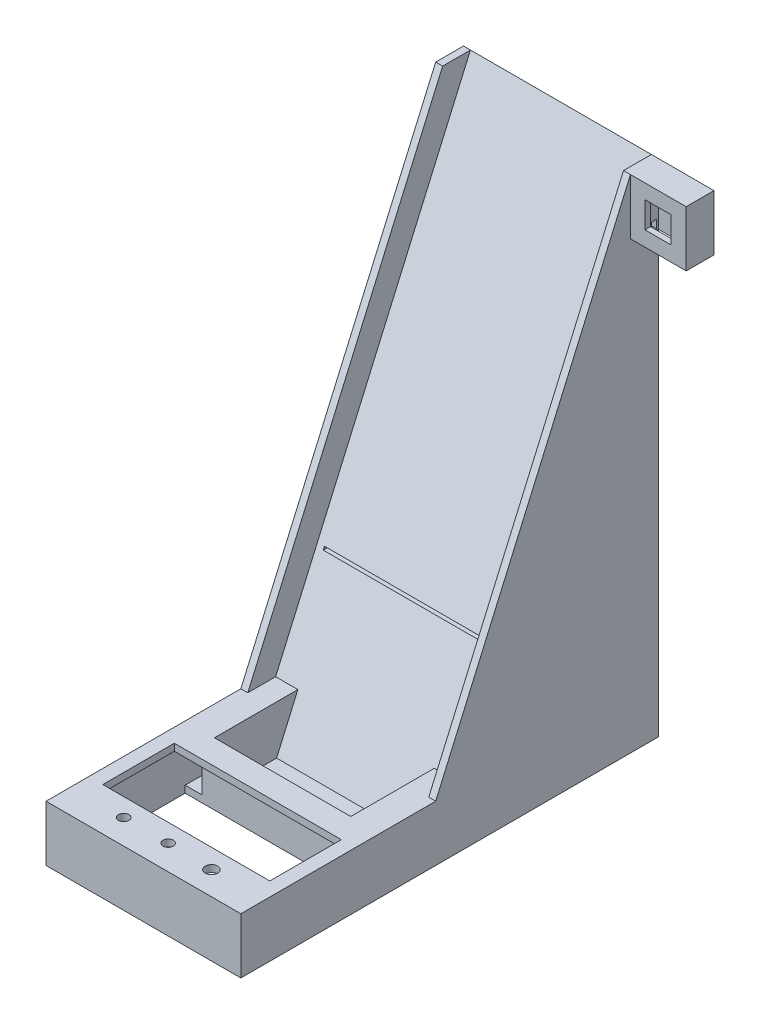
from build123d import *

# Parameters (mm, degrees)
SKETCH3_W                       = 88.9
SKETCH3_H                       = 203.2
BOSS_EXTRUDE2_DEPTH             = 88.9
CUT_EXTRUDE1_DEPTH              = 101.6
SHELL2_T                        = -3.175
SKETCH5_W                       = 88.9
SKETCH5_H                       = 25.4
BOSS_EXTRUDE3_DEPTH             = 190.5
SHELL4_START                    = -41.275
SHELL4_DEPTH                    = 82.55
CUT_EXTRUDE2_REACH              = 284.057
SKETCH7_W                       = 82.55
SKETCH7_H                       = 38.1
BOSS_EXTRUDE4_REACH             = 246.475
BOSS_EXTRUDE5_REACH             = 284.057
SKETCH10_W                      = 88.9
SKETCH10_H                      = 3.175
CUT_EXTRUDE7_REACH              = 302.872
SKETCH13_W                      = 82.55
SKETCH13_H                      = 57.15
BOSS_EXTRUDE6_START             = -3.175
BOSS_EXTRUDE6_DEPTH             = 3.175
BOSS_EXTRUDE7_REACH             = 284.057
SKETCH16_W                      = 82.55
SKETCH16_H                      = 3.175
CUT_EXTRUDE8_REACH              = 302.872
SKETCH17_W                      = 82.55
SKETCH17_H                      = 76.2
BOSS_EXTRUDE8_REACH             = 286.353
SKETCH18_W                      = 82.548541704
SKETCH18_H                      = 0.29056195
BOSS_EXTRUDE9_REACH             = 246.475
CUT_EXTRUDE9_REACH              = 173.426
SKETCH23_W                      = 76.2
SKETCH23_H                      = 1.27
BOSS_EXTRUDE10_DEPTH            = 12.7
BOSS_EXTRUDE11_REACH            = 184.601
SKETCH25_W                      = 5.715
SKETCH25_H                      = 2.188780981
SKETCH26_W                      = 12.7
SKETCH26_H                      = 25.4
BOSS_EXTRUDE12_DEPTH            = 25.4
SKETCH27_W                      = 20.32
SKETCH27_H                      = 7.62
CUT_EXTRUDE10_DEPTH             = 22.86
SKETCH29_W                      = 2.286
SKETCH29_H                      = 3.81
CUT_EXTRUDE12_DEPTH             = 19.304
CUT_EXTRUDE13_REACH             = 231.392
SKETCH30_W                      = 11.938
SKETCH30_H                      = 11.938
CUT_EXTRUDE14_REACH             = 220.743
SKETCH31_W                      = 14.238530822
SKETCH31_H                      = 87.346215886
CUT_EXTRUDE16_REACH             = 194.71
SKETCH32_W                      = 7.62
SKETCH32_H                      = 19.05
CUT_EXTRUDE16_DIRECTION_2_DEPTH = 56.896
BOSS_EXTRUDE13_REACH            = 194.71
CUT_EXTRUDE17_REACH             = 291.413
SKETCH34_W                      = 76.2
SKETCH34_H                      = 32.639
CUT_EXTRUDE18_REACH             = 291.413
SKETCH35_R                      = 2.3495
SKETCH35_R_2                    = 2.83553705


# Read off the part's stored shape, not the designer's step: Shell4
with BuildPart() as part:
    # Sketch3 → Boss-Extrude2 (new body)
    with BuildSketch(Plane.XY):
        Rectangle(SKETCH3_W, SKETCH3_H)
    extrude(amount=BOSS_EXTRUDE2_DEPTH)

    # Sketch4 → Cut-Extrude1 (cut)
    with BuildSketch(Plane(origin=(44.45, 0, 0), x_dir=(0, 0, -1), z_dir=(1, 0, 0))):
        Polygon((0, 101.6), (-88.9, -101.6), (-88.9, 101.6), align=None)
    extrude(amount=-CUT_EXTRUDE1_DEPTH, mode=Mode.SUBTRACT)

    # Shell2
    shell2_openings = [part.faces().sort_by_distance(p)[0] for p in [
        (0, 0, 0),
        (0, -101.6, 44.45),
    ]]
    offset(amount=SHELL2_T, openings=shell2_openings, kind=Kind.INTERSECTION)

    # Sketch5 → Boss-Extrude3 (add)
    with BuildSketch(Plane.XY):
        with Locations((0, -114.3)):
            Rectangle(SKETCH5_W, SKETCH5_H)
    extrude(amount=BOSS_EXTRUDE3_DEPTH)

    # Shell4 outline → Shell4 (cut)
    with BuildSketch(Plane.YZ.offset(SHELL4_START)):
        Polygon((-123.825, 3.175), (-101.6, 3.175), (-101.6, 85.43443805), (-104.775, 86.82350055), (-104.775, 187.325), (-123.825, 187.325), align=None)
    extrude(amount=SHELL4_DEPTH, mode=Mode.SUBTRACT)

    # Sketch7 → Cut-Extrude2 (cut, up to next)
    with BuildSketch(Plane(origin=(0, -101.6, 0), x_dir=(1, 0, 0), z_dir=(0, 1, 0)), mode=Mode.PRIVATE) as cut_extrude2_sk1:
        with Locations((0, -107.95)):
            Rectangle(SKETCH7_W, SKETCH7_H)
    cut_extrude2_tool1 = extrude(cut_extrude2_sk1.sketch, amount=-CUT_EXTRUDE2_REACH, mode=Mode.PRIVATE) & part.part
    add(cut_extrude2_tool1.solids().sort_by_distance((0, -101.6, 107.95))[0], mode=Mode.SUBTRACT)

    # Sketch9 → Boss-Extrude4 (add, up to next)
    with BuildSketch(Plane.ZY.offset(-41.275), mode=Mode.PRIVATE) as boss_extrude4_sk1:
        Polygon((88.9, -101.6), (98.6234375, -123.825), (95.4484375, -123.825), (85.725, -101.6), align=None)
    boss_extrude4_tool1 = extrude(boss_extrude4_sk1.sketch, amount=BOSS_EXTRUDE4_REACH, mode=Mode.PRIVATE) - part.part
    add(boss_extrude4_tool1.solids().sort_by_distance((41.275, -112.7125, 92.174219))[0])

    # Sketch10 → Boss-Extrude5 (add, up to next)
    with BuildSketch(Plane(origin=(0, -101.6, 0), x_dir=(1, 0, 0), z_dir=(0, 1, 0)), mode=Mode.PRIVATE) as boss_extrude5_sk1:
        with Locations((0, -128.5875)):
            Rectangle(SKETCH10_W, SKETCH10_H)
    boss_extrude5_tool1 = extrude(boss_extrude5_sk1.sketch, amount=-BOSS_EXTRUDE5_REACH, mode=Mode.PRIVATE) - part.part
    add(boss_extrude5_tool1.solids().sort_by_distance((0, -101.6, 128.5875))[0])

    # Sketch13 → Cut-Extrude7 (cut, up to next)
    with BuildSketch(Plane.XZ.offset(127), mode=Mode.PRIVATE) as cut_extrude7_sk1:
        with Locations((0, 158.75)):
            Rectangle(SKETCH13_W, SKETCH13_H)
    cut_extrude7_tool1 = extrude(cut_extrude7_sk1.sketch, amount=-CUT_EXTRUDE7_REACH, mode=Mode.PRIVATE) & part.part
    add(cut_extrude7_tool1.solids().sort_by_distance((0, -127, 158.75))[0], mode=Mode.SUBTRACT)

    # Sketch14 → Boss-Extrude6 (add)
    with BuildSketch(Plane(origin=(44.45, 0, 0), x_dir=(0, 0, -1), z_dir=(1, 0, 0)).offset(BOSS_EXTRUDE6_START)):
        Polygon((0, 101.6), (-12.7, 101.6), (-101.6, -101.6), (-88.9, -101.6), align=None)
    boss_extrude6 = extrude(amount=BOSS_EXTRUDE6_DEPTH)

    # Mirror1: Boss-Extrude6 across plane
    add(boss_extrude6.mirror(Plane(origin=(0, 0, 0), x_dir=(0, 0, 1), z_dir=(1, 0, 0))))

    # Sketch16 → Boss-Extrude7 (add, up to next)
    with BuildSketch(Plane(origin=(0, -101.6, 0), x_dir=(1, 0, 0), z_dir=(0, 1, 0)), mode=Mode.PRIVATE) as boss_extrude7_sk1:
        with Locations((0, -1.5875)):
            Rectangle(SKETCH16_W, SKETCH16_H)
    boss_extrude7_tool1 = extrude(boss_extrude7_sk1.sketch, amount=BOSS_EXTRUDE7_REACH, mode=Mode.PRIVATE) - part.part
    add(boss_extrude7_tool1.solids().sort_by_distance((0, -101.6, 1.5875))[0])

    # Sketch17 → Cut-Extrude8 (cut, up to next)
    with BuildSketch(Plane.XZ.offset(127), mode=Mode.PRIVATE) as cut_extrude8_sk1:
        with Locations((0, 41.275)):
            Rectangle(SKETCH17_W, SKETCH17_H)
    cut_extrude8_tool1 = extrude(cut_extrude8_sk1.sketch, amount=-CUT_EXTRUDE8_REACH, mode=Mode.PRIVATE) & part.part
    add(cut_extrude8_tool1.solids().sort_by_distance((0, -127, 41.275))[0], mode=Mode.SUBTRACT)

    # Sketch18 → Boss-Extrude8 (add, up to next)
    with BuildSketch(Plane.XZ.offset(104.775), mode=Mode.PRIVATE) as boss_extrude8_sk1:
        with Locations((-0.000729148, 86.968781525)):
            Rectangle(SKETCH18_W, SKETCH18_H)
    boss_extrude8_tool1 = extrude(boss_extrude8_sk1.sketch, amount=BOSS_EXTRUDE8_REACH, mode=Mode.PRIVATE) - part.part
    add(boss_extrude8_tool1.solids().sort_by_distance((-0.000729, -104.775, 86.968782))[0])

    # Sketch19 → Boss-Extrude9 (add, up to next)
    with BuildSketch(Plane(origin=(-41.275, 0, 0), x_dir=(0, 0, -1), z_dir=(1, 0, 0)), mode=Mode.PRIVATE) as boss_extrude9_sk1:
        Polygon((-26.67, -127), (-23.495, -127), (-23.495, 39.9758584), (-26.67, 32.718715543), align=None)
    boss_extrude9_tool1 = extrude(boss_extrude9_sk1.sketch, amount=BOSS_EXTRUDE9_REACH, mode=Mode.PRIVATE) - part.part
    add(boss_extrude9_tool1.solids().sort_by_distance((-41.275, -45.312922, 25.070745))[0])

    # Cut-Extrude9: up to this plane
    cut_extrude9_end = Plane(origin=(-57.15, 100.327400202, -2.908799538), z_dir=(0, -0.40081883401970775, -0.9161573349021892))
    # Sketch23 → Cut-Extrude9 (cut, up to the surface)
    with BuildSketch(Plane(origin=(0, 0, 84.28350055), x_dir=(-1, 0, 0), z_dir=(0, 0, -1)), mode=Mode.PRIVATE) as cut_extrude9_sk1:
        with Locations((0, -58.605922581)):
            Rectangle(SKETCH23_W, SKETCH23_H)
    cut_extrude9_tool1 = split(extrude(cut_extrude9_sk1.sketch, amount=CUT_EXTRUDE9_REACH, mode=Mode.PRIVATE), bisect_by=cut_extrude9_end, keep=Keep.BOTH, mode=Mode.PRIVATE)
    add(cut_extrude9_tool1.solids().sort_by_distance((0, -58.605923, 84.283501))[0], mode=Mode.SUBTRACT)

    # Sketch24 → Boss-Extrude10 (add)
    with BuildSketch(Plane.XY.offset(67.056)):
        Polygon((-35.56, -59.240922581), (-35.56, -61.780922581), (-41.275, -61.780922581), (-41.275, -55.430922581), (-35.56, -55.430922581), (-35.56, -57.970922581), (-38.1, -57.970922581), (-38.1, -59.240922581), align=None)
    boss_extrude10 = extrude(amount=-BOSS_EXTRUDE10_DEPTH)

    # Sketch25 → Boss-Extrude11 (add, up to next)
    with BuildSketch(Plane.XY.offset(67.056), mode=Mode.PRIVATE) as boss_extrude11_sk1:
        with Locations((-38.4175, -60.686532091)):
            Rectangle(SKETCH25_W, SKETCH25_H)
    boss_extrude11_tool1 = extrude(boss_extrude11_sk1.sketch, amount=BOSS_EXTRUDE11_REACH, mode=Mode.PRIVATE) - part.part
    add(boss_extrude11_tool1.solids().sort_by_distance((-38.4175, -60.686532, 67.056))[0])

    # Mirror2: Boss-Extrude10 across plane
    add(boss_extrude10.mirror(Plane(origin=(0, 0, 0), x_dir=(0, 0, 1), z_dir=(1, 0, 0))))

    # Sketch26 → Boss-Extrude12 (add)
    with BuildSketch(Plane(origin=(44.45, 0, 0), x_dir=(0, 0, -1), z_dir=(1, 0, 0))):
        with Locations((-6.35, 88.9)):
            Rectangle(SKETCH26_W, SKETCH26_H)
    extrude(amount=BOSS_EXTRUDE12_DEPTH)

    # Sketch27 → Cut-Extrude10 (cut)
    with BuildSketch(Plane.XZ.offset(-76.2)):
        with Locations((57.15, 6.35)):
            Rectangle(SKETCH27_W, SKETCH27_H)
    extrude(amount=-CUT_EXTRUDE10_DEPTH, mode=Mode.SUBTRACT)

    # Sketch29 → Cut-Extrude12 (cut)
    with BuildSketch(Plane(origin=(46.99, 0, 0), x_dir=(0, 0, -1), z_dir=(1, 0, 0))):
        with Locations((-4.445, 78.613)):
            Rectangle(SKETCH29_W, SKETCH29_H)
    extrude(amount=-CUT_EXTRUDE12_DEPTH, mode=Mode.SUBTRACT)

    # Sketch30 → Cut-Extrude13 (cut, up to next)
    with BuildSketch(Plane.XY.offset(12.7), mode=Mode.PRIVATE) as cut_extrude13_sk1:
        with Locations((57.023, 89.027)):
            Rectangle(SKETCH30_W, SKETCH30_H)
    cut_extrude13_tool1 = extrude(cut_extrude13_sk1.sketch, amount=-CUT_EXTRUDE13_REACH, mode=Mode.PRIVATE) & part.part
    add(cut_extrude13_tool1.solids().sort_by_distance((57.023, 89.027, 12.7))[0], mode=Mode.SUBTRACT)

    # Sketch31 → Cut-Extrude14 (cut, up to next)
    with BuildSketch(Plane.XY.offset(26.67), mode=Mode.PRIVATE) as cut_extrude14_sk1:
        with Locations((31.316857017, -69.910616217)):
            Rectangle(SKETCH31_W, SKETCH31_H)
    cut_extrude14_tool1 = extrude(cut_extrude14_sk1.sketch, amount=-CUT_EXTRUDE14_REACH, mode=Mode.PRIVATE) & part.part
    add(cut_extrude14_tool1.solids().sort_by_distance((31.316857, -69.910616, 26.67))[0], mode=Mode.SUBTRACT)

    # Sketch32 → Cut-Extrude16 (cut, up to next)
    with BuildSketch(Plane(origin=(0, 0, 127), x_dir=(-1, 0, 0), z_dir=(0, 0, -1)), mode=Mode.PRIVATE) as cut_extrude16_sk1:
        with Locations((-37.465, -114.3)):
            Rectangle(SKETCH32_W, SKETCH32_H)
    cut_extrude16_tool1 = extrude(cut_extrude16_sk1.sketch, amount=-CUT_EXTRUDE16_REACH, mode=Mode.PRIVATE) & part.part
    cut_extrude16 = cut_extrude16_tool1.solids().sort_by_distance((37.465, -114.3, 127))[0]
    add(cut_extrude16, mode=Mode.SUBTRACT)

    # Sketch32 → Cut-Extrude16 direction 2 (cut)
    with BuildSketch(Plane(origin=(0, 0, 127), x_dir=(-1, 0, 0), z_dir=(0, 0, -1))):
        with Locations((-37.465, -114.3)):
            Rectangle(SKETCH32_W, SKETCH32_H)
    cut_extrude16_direction_2 = extrude(amount=CUT_EXTRUDE16_DIRECTION_2_DEPTH, mode=Mode.SUBTRACT)

    # Mirror5: Cut-Extrude16, Cut-Extrude16 direction 2 across plane
    add(cut_extrude16.mirror(Plane(origin=(0, 0, 0), x_dir=(0, 0, 1), z_dir=(1, 0, 0))), mode=Mode.SUBTRACT)
    add(cut_extrude16_direction_2.mirror(Plane(origin=(0, 0, 0), x_dir=(0, 0, 1), z_dir=(1, 0, 0))), mode=Mode.SUBTRACT)

    # Boss-Extrude13: up to this plane
    boss_extrude13_end = Plane(origin=(-57.15, 101.6, 0), z_dir=(0, -0.40081883401970775, -0.9161573349021892))
    # Sketch33 → Boss-Extrude13 (add, up to the surface)
    with BuildSketch(Plane(origin=(0, 0, 127), x_dir=(-1, 0, 0), z_dir=(0, 0, -1)), mode=Mode.PRIVATE) as boss_extrude13_sk1:
        Polygon((-31.115, -101.6), (-41.275, -101.6), (-41.275, -104.775), (-33.655, -104.775), (-33.655, -123.825), (-31.115, -123.825), align=None)
    boss_extrude13_tool1 = split(extrude(boss_extrude13_sk1.sketch, amount=BOSS_EXTRUDE13_REACH, mode=Mode.PRIVATE), bisect_by=boss_extrude13_end, keep=Keep.BOTH, mode=Mode.PRIVATE)
    boss_extrude13 = boss_extrude13_tool1.solids().sort_by_distance((36.195, -101.844372, 127))[0]
    add(boss_extrude13)

    # Mirror6: Boss-Extrude13 across plane
    add(boss_extrude13.mirror(Plane(origin=(0, 0, 0), x_dir=(0, 0, 1), z_dir=(1, 0, 0))))

    # Sketch34 → Cut-Extrude17 (cut, up to next)
    with BuildSketch(Plane.XZ.offset(104.775), mode=Mode.PRIVATE) as cut_extrude17_sk1:
        with Locations((0, 154.6225)):
            Rectangle(SKETCH34_W, SKETCH34_H)
    cut_extrude17_tool1 = extrude(cut_extrude17_sk1.sketch, amount=-CUT_EXTRUDE17_REACH, mode=Mode.PRIVATE) & part.part
    add(cut_extrude17_tool1.solids().sort_by_distance((0, -104.775, 154.6225))[0], mode=Mode.SUBTRACT)

    # Sketch35 → Cut-Extrude18 (cut, up to next)
    with BuildSketch(Plane.XZ.offset(104.775), mode=Mode.PRIVATE) as cut_extrude18_sk1:
        with Locations(Location((0, 179.197, 0), (0, 0, 270))):
            Circle(SKETCH35_R)
    cut_extrude18_tool1 = extrude(cut_extrude18_sk1.sketch, amount=-CUT_EXTRUDE18_REACH, mode=Mode.PRIVATE) & part.part
    # Sketch35 → Cut-Extrude18 (cut, up to next)
    with BuildSketch(Plane.XZ.offset(104.775), mode=Mode.PRIVATE) as cut_extrude18_sk2:
        with Locations(Location((20.32, 179.780535398, 0), (0, 0, 270))):
            Circle(SKETCH35_R_2)
    cut_extrude18_tool2 = extrude(cut_extrude18_sk2.sketch, amount=-CUT_EXTRUDE18_REACH, mode=Mode.PRIVATE) & part.part
    # Sketch35 → Cut-Extrude18 (cut, up to next)
    with BuildSketch(Plane.XZ.offset(104.775), mode=Mode.PRIVATE) as cut_extrude18_sk3:
        with Locations(Location((-20.32, 179.197, 0), (0, 0, 270))):
            Circle(SKETCH35_R)
    cut_extrude18_tool3 = extrude(cut_extrude18_sk3.sketch, amount=-CUT_EXTRUDE18_REACH, mode=Mode.PRIVATE) & part.part
    add(cut_extrude18_tool1.solids().sort_by_distance((0, -104.775, 179.197))[0], mode=Mode.SUBTRACT)
    add(cut_extrude18_tool2.solids().sort_by_distance((20.32, -104.775, 179.780535))[0], mode=Mode.SUBTRACT)
    add(cut_extrude18_tool3.solids().sort_by_distance((-20.32, -104.775, 179.197))[0], mode=Mode.SUBTRACT)


solid = part.part
